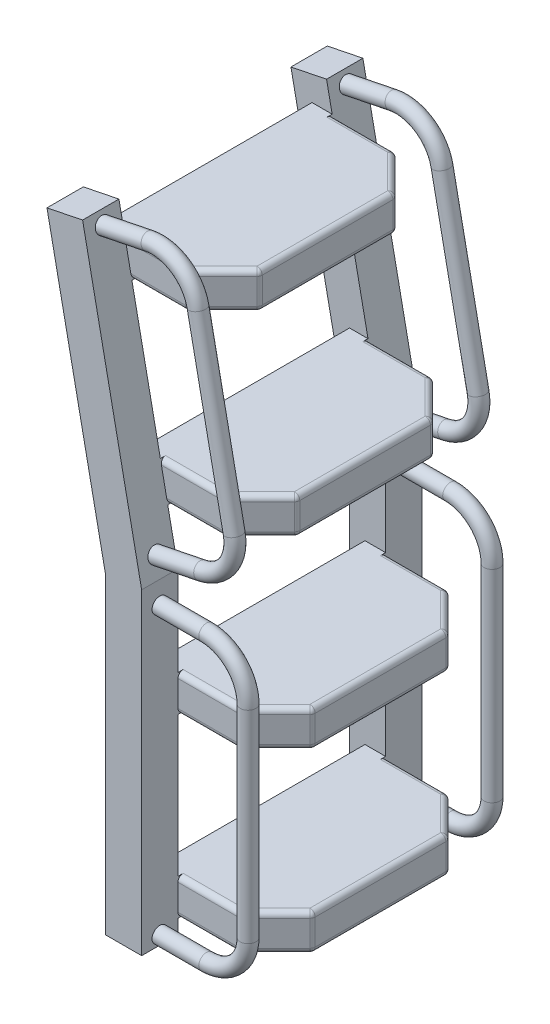
from build123d import *

# Parameters (mm, degrees)
SURFACE_EXTRUDE1_1_DEPTH = 70
THICKEN1_T1              = 70
THICKEN2_START           = -470
THICKEN2_DEPTH           = 70
SKETCH3_W                = 230
SKETCH3_H                = 70
BOSS_EXTRUDE1_DEPTH      = 400
CHAMFER1_SIZE            = 70
FILLET1_R                = 10
SWEEP1_PROFILE_R         = 15
SWEEP2_PROFILE_R         = 15


# Read off the part's stored shape, not the designer's step: Thicken2
with BuildPart() as body_1:
    # Surface-Extrude1: a surface, the sketch's curves swept straight by 70 mm
    with BuildLine(Plane.XY, mode=Mode.PRIVATE) as surface_extrude1_1_path:
        Line((56.880725069, -338.165009379), (56.880725069, 272.304843278))
        Line((56.880725069, 272.304843278), (-56.880725069, 832.344829599))
    surface_extrude1_1 = Shell.extrude(surface_extrude1_1_path.wire(), (0 * SURFACE_EXTRUDE1_1_DEPTH, 0 * SURFACE_EXTRUDE1_1_DEPTH, 1 * SURFACE_EXTRUDE1_1_DEPTH))
    add(Solid.thicken(surface_extrude1_1, THICKEN1_T1))



with BuildPart() as body_2:
    # Thicken2 outline → Thicken2 (new body)
    with BuildSketch(Plane.XY.offset(THICKEN2_START)):
        Polygon((56.880725069, 272.304843278), (-56.880725069, 832.344829599), (-125.479757919, 818.410243416), (-13.119274931, 265.26712438), (-13.119274931, -338.165009379), (56.880725069, -338.165009379), align=None)
    extrude(amount=THICKEN2_DEPTH)


with BuildPart() as body_1_1:
    add(body_1.part)

    add(body_2.part)  # Boss-Extrude1 merges body 2
    # Sketch3 → Boss-Extrude1 (add)
    with BuildSketch(Plane(origin=(0, 0, 0), x_dir=(-1, 0, 0), z_dir=(0, 0, -1))):
        with Locations((-132.122180749, -275.653253075)):
            Rectangle(SKETCH3_W, SKETCH3_H)
        with Locations((-132.122180749, 64.346746925)):
            Rectangle(SKETCH3_W, SKETCH3_H)
        with Locations((-102.37603515, 404.346746925)):
            Rectangle(SKETCH3_W, SKETCH3_H)
        with Locations((-30.106804183, 744.346746925)):
            Rectangle(SKETCH3_W, SKETCH3_H)
    extrude(amount=BOSS_EXTRUDE1_DEPTH)

    # Chamfer1
    chamfer1_edges = [body_1_1.edges().sort_by_distance(p)[0] for p in [
        (247.122180749, -275.653253075, -400),
        (247.122180749, -275.653253075, 0),
        (247.122180749, 64.346746925, -400),
        (247.122180749, 64.346746925, 0),
        (217.37603515, 404.346746925, -400),
        (217.37603515, 404.346746925, 0),
        (145.106804183, 744.346746925, -400),
        (145.106804183, 744.346746925, 0),
    ]]
    chamfer(chamfer1_edges, length=CHAMFER1_SIZE)

    # Fillet1
    fillet1_edges = [body_1_1.edges().sort_by_distance(p)[0] for p in [
        (247.122180749, -240.653253075, -200),
        (247.122180749, -275.653253075, -330),
        (247.122180749, -275.653253075, -70),
        (117.001452909, -310.653253075, 0),
        (212.122180749, -310.653253075, -365),
        (212.122180749, -310.653253075, -35),
        (177.122180749, -275.653253075, 0),
        (117.001452909, -240.653253075, -400),
        (212.122180749, -240.653253075, -365),
        (212.122180749, -240.653253075, -35),
        (247.122180749, 29.346746925, -200),
        (247.122180749, 99.346746925, -200),
        (247.122180749, 64.346746925, -330),
        (247.122180749, 64.346746925, -70),
        (117.001452909, 29.346746925, 0),
        (212.122180749, 29.346746925, -365),
        (212.122180749, 29.346746925, -35),
        (177.122180749, 64.346746925, 0),
        (117.001452909, 99.346746925, -400),
        (212.122180749, 99.346746925, -365),
        (212.122180749, 99.346746925, -35),
        (217.37603515, 369.346746925, -200),
        (217.37603515, 439.346746925, -200),
        (217.37603515, 404.346746925, -330),
        (217.37603515, 404.346746925, -70),
        (92.272273445, 369.346746925, 0),
        (182.37603515, 369.346746925, -365),
        (182.37603515, 369.346746925, -35),
        (147.37603515, 404.346746925, 0),
        (85.162690465, 439.346746925, -400),
        (182.37603515, 439.346746925, -365),
        (182.37603515, 439.346746925, -35),
        (177.122180749, -275.653253075, -400),
        (177.122180749, 64.346746925, -400),
        (147.37603515, 404.346746925, -400),
        (145.106804183, 709.346746925, -200),
        (145.106804183, 779.346746925, -200),
        (145.106804183, 744.346746925, -70),
        (145.106804183, 744.346746925, -330),
        (14.495814793, 779.346746925, -400),
        (110.106804183, 779.346746925, -35),
        (110.106804183, 779.346746925, -365),
        (75.106804183, 744.346746925, -400),
        (21.605397773, 709.346746925, 0),
        (110.106804183, 709.346746925, -35),
        (110.106804183, 709.346746925, -365),
        (75.106804183, 744.346746925, 0),
        (117.001452909, -240.653253075, 0),
        (117.001452909, -310.653253075, -400),
        (117.001452909, 29.346746925, -400),
        (117.001452909, 99.346746925, 0),
        (92.272273445, 369.346746925, -400),
        (85.162690465, 439.346746925, 0),
        (21.605397773, 709.346746925, -400),
        (14.495814793, 779.346746925, 0),
        (247.122180749, -310.653253075, -200),
    ]]
    fillet(fillet1_edges, radius=FILLET1_R)

    # Sweep1: sweep along a path in Sketch6
    with BuildLine(Plane.YX.offset(435)) as sweep1_path:
        Line((-320.090393617, 56.880725069), (-320.090393617, 146.880725069))
        ThreePointArc((-320.090393617, 146.880725069), (-296.658936112, 203.449267564), (-240.090393617, 226.880725069))
        Line((-240.090393617, 226.880725069), (149.397698337, 226.880725069))
        ThreePointArc((149.397698337, 226.880725069), (205.966240832, 203.449267564), (229.397698337, 146.880725069))
        Line((229.397698337, 146.880725069), (229.397698337, 56.880725069))
    # Sweep1 profile (on start of the path) → Sweep1 (sweep)
    with BuildSketch(Plane(origin=(56.880725069, -320.090393617, -435), x_dir=(0, 0, 1), z_dir=(1, 0, 0))):
        Circle(SWEEP1_PROFILE_R)
    sweep1 = sweep(path=sweep1_path.line)

    # Mirror1: Sweep1 across plane
    add(sweep1.mirror(Plane(origin=(0, 0, -200), x_dir=(1, 0, 0), z_dir=(0, 0, -1))))

    # Sweep2: sweep along a path in Sketch22
    with BuildLine(Plane(origin=(0, 0, -435), x_dir=(0.19906551689452334, -0.9799861835676645, 0), z_dir=(0, 0, 1))) as sweep2_path:
        Line((-802.890794967, 109.948829059), (-802.890794967, 199.948829059))
        ThreePointArc((-802.890794967, 199.948829059), (-779.459337462, 256.517371554), (-722.890794967, 279.948829059))
        Line((-722.890794967, 279.948829059), (-373.586221002, 279.948829059))
        ThreePointArc((-373.586221002, 279.948829059), (-317.017678507, 256.517371554), (-293.586221002, 199.948829059))
        Line((-293.586221002, 199.948829059), (-293.586221002, 109.948829059))
    # Sweep2 profile (on start of the path) → Sweep2 (sweep)
    with BuildSketch(Plane(origin=(-52.079537732, 808.70890647, -435), x_dir=(-0.19906551689452334, 0.9799861835676645, 0), z_dir=(0.9799861835676645, 0.19906551689452334, 0))):
        Circle(SWEEP2_PROFILE_R)
    sweep2 = sweep(path=sweep2_path.line)

    # Mirror2: Sweep2 across plane
    add(sweep2.mirror(Plane(origin=(0, 0, -200), x_dir=(1, 0, 0), z_dir=(0, 0, -1))))


solid = body_1_1.part
